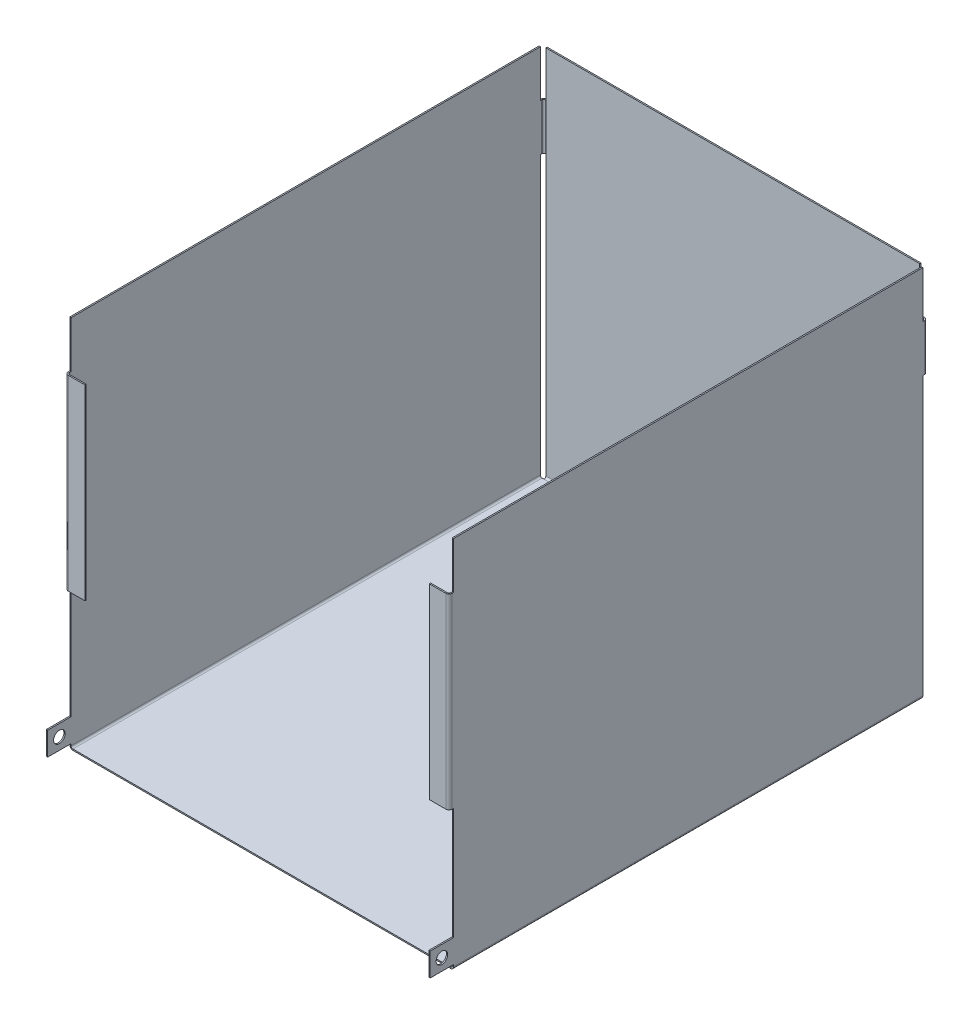
from build123d import *

# Parameters (mm, degrees)
SKETCH2_W           = 203.2
SKETCH2_H           = 254
BASE_FLANGE1_DEPTH  = 0.7
EDGE_FLANGE4_DEPTH  = 203.2
EDGE_FLANGE5_DEPTH  = 255
EDGE_FLANGE6_DEPTH  = 255
EDGE_FLANGE7_DEPTH  = 25.4
EDGE_FLANGE9_DEPTH  = 25.4
EDGE_FLANGE10_DEPTH = 101.6
EDGE_FLANGE11_DEPTH = 101.6
SKETCH76_W          = 12.7
SKETCH76_H          = 12.7
TAB1_DEPTH          = 0.7
SKETCH79_W          = 12.7
SKETCH79_H          = 12.7
TAB2_DEPTH          = 0.7
SKETCH86_R          = 3.15
CUT_EXTRUDE3_DEPTH  = 323.546585783


# Sheet-metal steps are written as plain solids
with BuildPart() as part:
    # Sketch2 → Base-Flange1 (new body)
    with BuildSketch(Plane(origin=(0, 0, 0), x_dir=(1, 0, 0), z_dir=(0, 1, 0))):
        Rectangle(SKETCH2_W, SKETCH2_H)
    extrude(amount=-BASE_FLANGE1_DEPTH)

    # Edge-Flange4 section (across the edge) → Edge-Flange4 (add)
    with BuildSketch(Plane(origin=(101.6, 0, -129), x_dir=(0, 0, 1), z_dir=(-1, 0, 0))):
        with BuildLine():
            Line((-0.7, 1), (-0.7, 202.5))
            Line((-0.7, 202.5), (0, 202.5))
            Line((0, 202.5), (0, 1))
            ThreePointArc((0, 1), (0.292893219, 0.292893219), (1, 0))
            Line((1, 0), (2, 0))
            Line((2, 0), (2, -0.7))
            Line((2, -0.7), (1, -0.7))
            ThreePointArc((1, -0.7), (-0.202081528, -0.202081528), (-0.7, 1))
        make_face()
    extrude(amount=EDGE_FLANGE4_DEPTH)

    # Edge-Flange5 section (across the edge) → Edge-Flange5 (add)
    with BuildSketch(Plane(origin=(-103.6, 0, -128), x_dir=(1, 0, 0), z_dir=(0, 0, 1))):
        with BuildLine():
            Line((-0.7, 1), (-0.7, 202.5))
            Line((-0.7, 202.5), (0, 202.5))
            Line((0, 202.5), (0, 1))
            ThreePointArc((0, 1), (0.292893219, 0.292893219), (1, 0))
            Line((1, 0), (2, 0))
            Line((2, 0), (2, -0.7))
            Line((2, -0.7), (1, -0.7))
            ThreePointArc((1, -0.7), (-0.202081528, -0.202081528), (-0.7, 1))
        make_face()
    extrude(amount=EDGE_FLANGE5_DEPTH)

    # Edge-Flange6 section (across the edge) → Edge-Flange6 (add)
    with BuildSketch(Plane(origin=(103.6, 0, 127), x_dir=(-1, 0, 0), z_dir=(0, 0, -1))):
        with BuildLine():
            Line((-0.7, 1), (-0.7, 202.5))
            Line((-0.7, 202.5), (0, 202.5))
            Line((0, 202.5), (0, 1))
            ThreePointArc((0, 1), (0.292893219, 0.292893219), (1, 0))
            Line((1, 0), (2, 0))
            Line((2, 0), (2, -0.7))
            Line((2, -0.7), (1, -0.7))
            ThreePointArc((1, -0.7), (-0.202081528, -0.202081528), (-0.7, 1))
        make_face()
    extrude(amount=EDGE_FLANGE6_DEPTH)

    # Edge-Flange7 section (across the edge) → Edge-Flange7 (add)
    with BuildSketch(Plane(origin=(-103.6, 151.7, -129.8), x_dir=(0, 0, 1), z_dir=(0, 1, 0))):
        with BuildLine():
            Line((-0.7, 1), (-0.7, 24.7))
            Line((-0.7, 24.7), (0, 24.7))
            Line((0, 24.7), (0, 1))
            ThreePointArc((0, 1), (0.292893219, 0.292893219), (1, 0))
            Line((1, 0), (1.8, 0))
            Line((1.8, 0), (1.8, -0.7))
            Line((1.8, -0.7), (1, -0.7))
            ThreePointArc((1, -0.7), (-0.202081528, -0.202081528), (-0.7, 1))
        make_face()
    extrude(amount=EDGE_FLANGE7_DEPTH)

    # Edge-Flange9 section (across the edge) → Edge-Flange9 (add)
    with BuildSketch(Plane(origin=(103.6, 177.1, -129.8), x_dir=(0, 0, 1), z_dir=(0, -1, 0))):
        with BuildLine():
            Line((-0.7, 1), (-0.7, 24.7))
            Line((-0.7, 24.7), (0, 24.7))
            Line((0, 24.7), (0, 1))
            ThreePointArc((0, 1), (0.292893219, 0.292893219), (1, 0))
            Line((1, 0), (1.8, 0))
            Line((1.8, 0), (1.8, -0.7))
            Line((1.8, -0.7), (1, -0.7))
            ThreePointArc((1, -0.7), (-0.202081528, -0.202081528), (-0.7, 1))
        make_face()
    extrude(amount=EDGE_FLANGE9_DEPTH)

    # Edge-Flange10 section (across the edge) → Edge-Flange10 (add)
    with BuildSketch(Plane(origin=(103.6, 75.5, 128.8), x_dir=(0, 0, -1), z_dir=(0, 1, 0))):
        with BuildLine():
            Line((-0.7, 1), (-0.7, 10))
            Line((-0.7, 10), (0, 10))
            Line((0, 10), (0, 1))
            ThreePointArc((0, 1), (0.292893219, 0.292893219), (1, 0))
            Line((1, 0), (1.8, 0))
            Line((1.8, 0), (1.8, -0.7))
            Line((1.8, -0.7), (1, -0.7))
            ThreePointArc((1, -0.7), (-0.202081528, -0.202081528), (-0.7, 1))
        make_face()
    extrude(amount=EDGE_FLANGE10_DEPTH)

    # Edge-Flange11 section (across the edge) → Edge-Flange11 (add)
    with BuildSketch(Plane(origin=(-103.6, 177.1, 128.8), x_dir=(0, 0, -1), z_dir=(0, -1, 0))):
        with BuildLine():
            Line((-0.7, 1), (-0.7, 10))
            Line((-0.7, 10), (0, 10))
            Line((0, 10), (0, 1))
            ThreePointArc((0, 1), (0.292893219, 0.292893219), (1, 0))
            Line((1, 0), (1.8, 0))
            Line((1.8, 0), (1.8, -0.7))
            Line((1.8, -0.7), (1, -0.7))
            ThreePointArc((1, -0.7), (-0.202081528, -0.202081528), (-0.7, 1))
        make_face()
    extrude(amount=EDGE_FLANGE11_DEPTH)

    # Sketch76 → Tab1 (add)
    with BuildSketch(Plane.ZY.offset(104.3)):
        with Locations((133.35, 8.35)):
            Rectangle(SKETCH76_W, SKETCH76_H)
    extrude(amount=-TAB1_DEPTH)

    # Sketch79 → Tab2 (add)
    with BuildSketch(Plane(origin=(104.3, 0, 0), x_dir=(0, 0, -1), z_dir=(1, 0, 0))):
        with Locations((-133.35, 8.35)):
            Rectangle(SKETCH79_W, SKETCH79_H)
    extrude(amount=-TAB2_DEPTH)

    # Sketch86 → Cut-Extrude3 (cut, through all)
    with BuildSketch(Plane(origin=(104.3, 0, 0), x_dir=(0, 0, -1), z_dir=(1, 0, 0))):
        with Locations(Location((-133.35, 8.35, 0), (0, 0, 90))):
            Circle(SKETCH86_R)
    extrude(amount=-CUT_EXTRUDE3_DEPTH, mode=Mode.SUBTRACT)


solid = part.part
